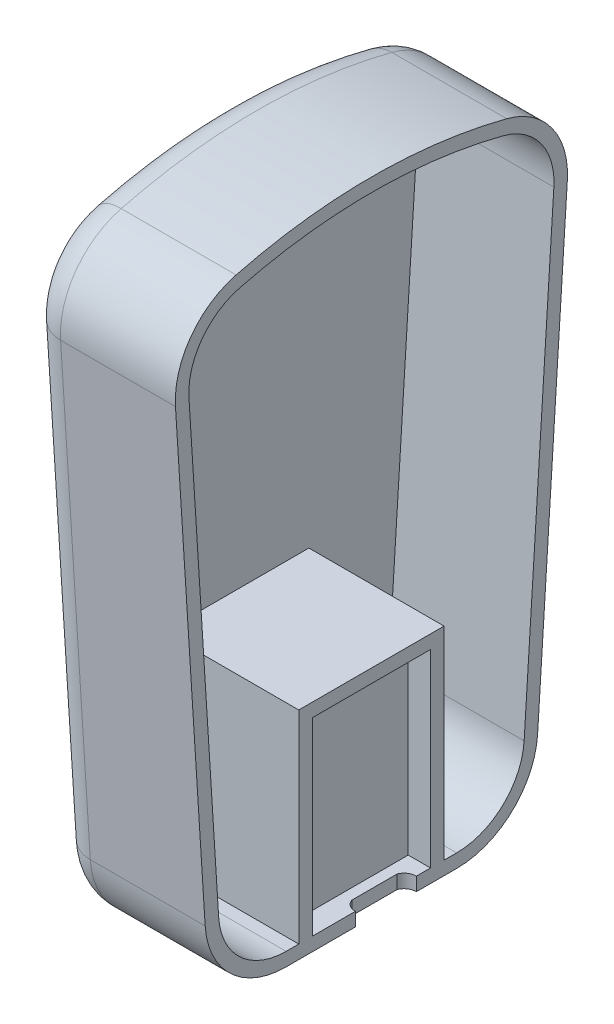
from build123d import *

# Parameters (mm, degrees)
BOSS_EXTRUDE1_DEPTH = 20
SHELL4_T            = 2
FILLET2_R           = 5
SKETCH3_W           = 21.5
SKETCH3_H           = 30
BOSS_EXTRUDE2_DEPTH = 20
SKETCH4_W           = 17.5
SKETCH4_H           = 28
CUT_EXTRUDE1_DEPTH  = 3.3
CUT_EXTRUDE2_DEPTH  = 2


with BuildPart() as part:
    # Sketch2 → Boss-Extrude1 (new body)
    with BuildSketch(Plane(origin=(0, 0, 0), x_dir=(0, 0, -1), z_dir=(1, 0, 0))):
        with BuildLine():
            Line((-27.001202387, 32.141013477), (-22.602835252, -36.63027149))
            ThreePointArc((-22.602835252, -36.63027149), (-19.464913087, -43.285247796), (-12.623224858, -45.992011054))
            Line((-12.623224858, -45.992011054), (12.623224858, -45.992011054))
            ThreePointArc((12.623224858, -45.992011054), (19.464913087, -43.285247796), (22.602835252, -36.63027149))
            Line((22.602835252, -36.63027149), (27.001202387, 32.141013477))
            ThreePointArc((27.001202387, 32.141013477), (25.118351891, 38.648045435), (19.520174304, 42.462098214))
            ThreePointArc((19.520174304, 42.462098214), (0, 44.940033366), (-19.520174304, 42.462098214))
            ThreePointArc((-19.520174304, 42.462098214), (-25.118351891, 38.648045435), (-27.001202387, 32.141013477))
        make_face()
    extrude(amount=BOSS_EXTRUDE1_DEPTH)

    # Shell4
    shell4_openings = [part.faces().sort_by_distance(p)[0] for p in [
        (20, 0.52350314, 0),
    ]]
    offset(amount=SHELL4_T, openings=shell4_openings, kind=Kind.INTERSECTION)

    # Fillet2
    # the kernel refuses this fillet: 5 mm, written as the material it takes off along each edge
    with BuildSketch(Plane(origin=(-2, -47.992011054, 12.623224858), x_dir=(1, 0, 0), z_dir=(0, 0, -1))) as fillet2_piece_1:
        with BuildLine():
            CenterArc((FILLET2_R, -FILLET2_R), FILLET2_R, 90, 90)
            Line((0, -FILLET2_R), (0, 0))
            Line((0, 0), (FILLET2_R, 0))
        make_face()
    extrude(amount=25.246449717, mode=Mode.SUBTRACT)
    with BuildSketch(Plane(origin=(-2, -35.992011054, 12.623224858), x_dir=(0, -1, 0), z_dir=(0, 0, -1))) as fillet2_piece_2:
        with BuildLine():
            CenterArc((12 - FILLET2_R, -FILLET2_R), FILLET2_R, 0, 90)
            Line((12 - FILLET2_R, 0), (12, 0))
            Line((12, 0), (12, -FILLET2_R))
        make_face()
    revolve(axis=Axis((-2, -35.992011054, 12.623224858), (-1, 0, 0)), revolution_arc=86.340549578, mode=Mode.SUBTRACT)
    with BuildSketch(Plane(origin=(-2, 32.01336139, 28.997124466), x_dir=(1, 0, 0), z_dir=(0, -0.997961039394411, -0.06382604367205215)), Plane(origin=(-2, -36.757923578, -24.598757331), x_dir=(1, 0, 0), z_dir=(0, 0.9979610393944109, -0.06382604367205376))) as fillet2_piece_3:
        with BuildLine():
            CenterArc((FILLET2_R, -FILLET2_R), FILLET2_R, 90, 90)
            Line((0, -FILLET2_R), (0, 0))
            Line((0, 0), (FILLET2_R, 0))
        make_face()
    extrude(amount=68.911793399, mode=Mode.SUBTRACT)
    with BuildSketch(Plane(origin=(-2, 32.779273914, 17.021591993), x_dir=(0, -0.06382604367205197, 0.997961039394411), z_dir=(0, -0.997961039394411, -0.06382604367205197))) as fillet2_piece_4:
        with BuildLine():
            CenterArc((12 - FILLET2_R, -FILLET2_R), FILLET2_R, 0, 90)
            Line((12 - FILLET2_R, 0), (12, 0))
            Line((12, 0), (12, -FILLET2_R))
        make_face()
    revolve(axis=Axis((-2, 32.779273914, 17.021591993), (-1, 0, 0)), revolution_arc=79.190327228, mode=Mode.SUBTRACT)
    with BuildSketch(Plane(origin=(-2, -33.184966634, 0), x_dir=(0, 0.9682824300555203, 0.249858231094708), z_dir=(0, -0.249858231094708, 0.9682824300555203))) as fillet2_piece_5:
        with BuildLine():
            CenterArc((80.125 - FILLET2_R, -FILLET2_R), FILLET2_R, 0, 90)
            Line((80.125 - FILLET2_R, 0), (80.125, 0))
            Line((80.125, 0), (80.125, -FILLET2_R))
        make_face()
    revolve(axis=Axis((-2, -33.184966634, 0), (-1, 0, 0)), revolution_arc=28.938246388, mode=Mode.SUBTRACT)
    with BuildSketch(Plane(origin=(-2, 32.779273914, -17.021591993), x_dir=(0, 0.9682824300555204, -0.24985823109470737), z_dir=(0, 0.24985823109470737, 0.9682824300555204))) as fillet2_piece_6:
        with BuildLine():
            CenterArc((12 - FILLET2_R, -FILLET2_R), FILLET2_R, 0, 90)
            Line((12 - FILLET2_R, 0), (12, 0))
            Line((12, 0), (12, -FILLET2_R))
        make_face()
    revolve(axis=Axis((-2, 32.779273914, -17.021591993), (-1, 0, 0)), revolution_arc=79.190327228, mode=Mode.SUBTRACT)
    with BuildSketch(Plane(origin=(-2, -35.992011054, -12.623224858), x_dir=(0, -0.06382604367205372, -0.9979610393944109), z_dir=(0, 0.9979610393944109, -0.06382604367205372))) as fillet2_piece_7:
        with BuildLine():
            CenterArc((12 - FILLET2_R, -FILLET2_R), FILLET2_R, 0, 90)
            Line((12 - FILLET2_R, 0), (12, 0))
            Line((12, 0), (12, -FILLET2_R))
        make_face()
    revolve(axis=Axis((-2, -35.992011054, -12.623224858), (-1, 0, 0)), revolution_arc=86.340549578, mode=Mode.SUBTRACT)

    # Sketch3 → Boss-Extrude2 (add)
    with BuildSketch(Plane(origin=(0, 0, 0), x_dir=(0, 0, -1), z_dir=(1, 0, 0))):
        with Locations((0, -30.992011054)):
            Rectangle(SKETCH3_W, SKETCH3_H)
    extrude(amount=BOSS_EXTRUDE2_DEPTH)

    # Sketch4 → Cut-Extrude1 (cut)
    with BuildSketch(Plane(origin=(20, 0, 0), x_dir=(0, 0, -1), z_dir=(1, 0, 0))):
        with Locations((0, -31.992011054)):
            Rectangle(SKETCH4_W, SKETCH4_H)
    extrude(amount=-CUT_EXTRUDE1_DEPTH, mode=Mode.SUBTRACT)

    # Sketch5 → Cut-Extrude2 (cut)
    with BuildSketch(Plane.XZ.offset(47.992011054)):
        with BuildLine():
            Line((20, 2.351775142), (20, -6.648224858))
            ThreePointArc((20, -6.648224858), (18.961461825, -6.347856856), (18.3, -5.492724858))
            Line((18.3, -5.492724858), (18.3, 1.197275142))
            ThreePointArc((18.3, 1.197275142), (18.954546218, 2.062330624), (20, 2.351775142))
        make_face()
    extrude(amount=-CUT_EXTRUDE2_DEPTH, mode=Mode.SUBTRACT)


solid = part.part
